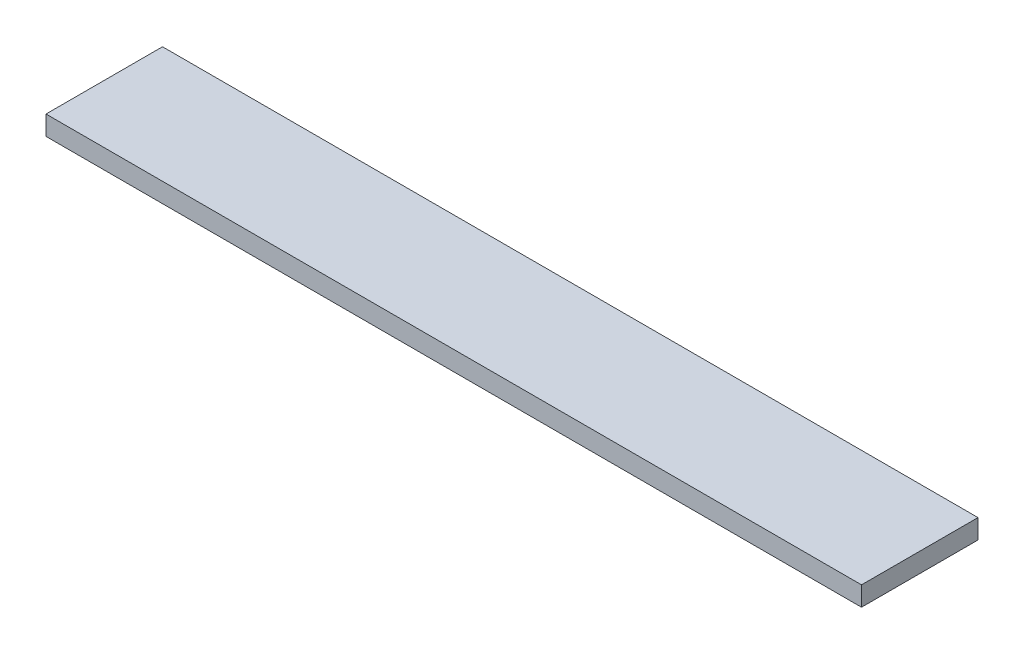
from build123d import *

# Parameters (mm, degrees)
SKETCH1_W           = 533.4
SKETCH1_H           = 76.2
BOSS_EXTRUDE1_DEPTH = 12.7


with BuildPart() as part:
    # Sketch1 → Boss-Extrude1 (new body)
    with BuildSketch(Plane(origin=(0, 0, 0), x_dir=(1, 0, 0), z_dir=(0, 1, 0))):
        with Locations((204.534474042, 2.936232023)):
            Rectangle(SKETCH1_W, SKETCH1_H)
    extrude(amount=BOSS_EXTRUDE1_DEPTH)


solid = part.part
